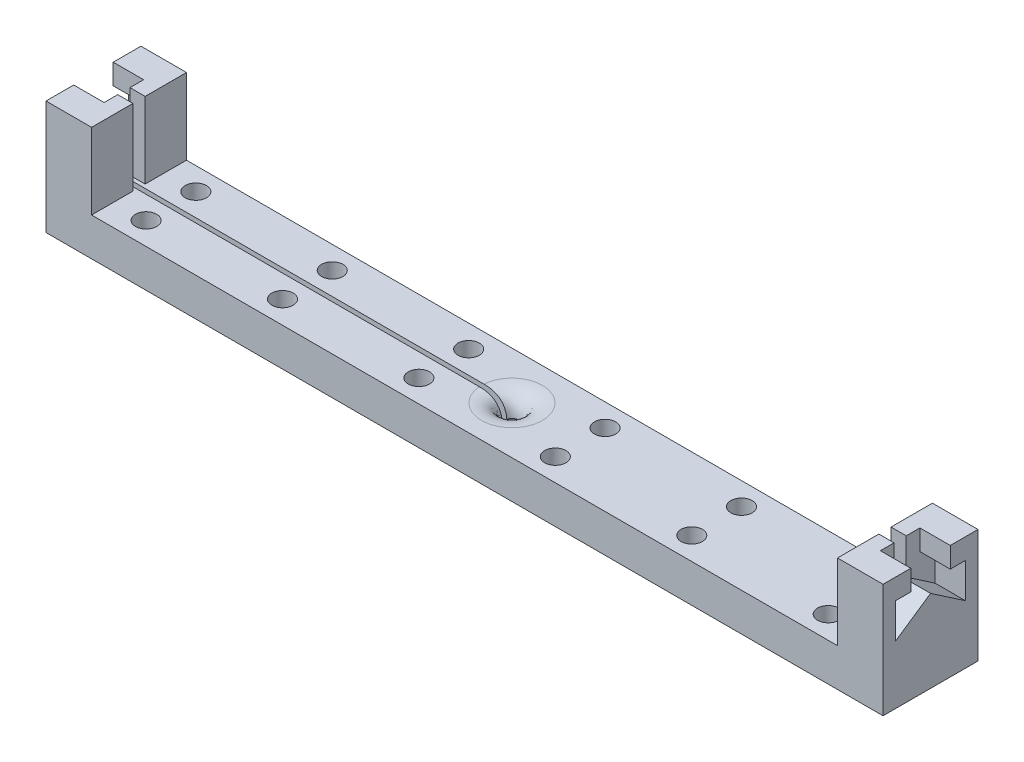
from build123d import *

# Parameters (mm, degrees)
SKETCH1_R                = 1.778
BOSS_EXTRUDE1_DEPTH      = 19.05
CUT_EXTRUDE1_DEPTH       = 143.133881397
SKETCH4_W                = 64.897
SKETCH4_H                = 12.7
CUT_EXTRUDE6_DEPTH       = 143.133881397
BOSS_EXTRUDE3_DEPTH      = 7.112
BOSS_EXTRUDE3_DEPTH_BACK = 6.35
SKETCH5_7_W              = 2.54
SKETCH5_7_H              = 6.9215
BOSS_EXTRUDE4_DEPTH      = 12.7
FILLET1_SIZE             = 3.81


with BuildPart() as part:
    # Sketch1 → Boss-Extrude1 (new body)
    with BuildSketch(Plane(origin=(0, 0, 0), x_dir=(1, 0, 0), z_dir=(0, 1, 0))):
        with BuildLine():
            Line((0, 7.5565), (0, 0))
            Line((0, 0), (139.954, 0))
            Line((139.954, 0), (139.954, 15.875))
            Line((139.954, 15.875), (0, 15.875))
            Line((0, 15.875), (0, 8.3185))
            Line((0, 8.3185), (68.765497214, 8.3185))
            ThreePointArc((68.765497214, 8.3185), (71.247, 7.9375), (68.765497214, 7.5565))
            Line((68.765497214, 7.5565), (0, 7.5565))
        make_face()
        with Locations(Location((127, 12.09675, 0), (0, 0, 90))):
            Circle(SKETCH1_R, mode=Mode.SUBTRACT)
        with Locations(Location((12.954, 3.77825, 0), (0, 0, 90))):
            Circle(SKETCH1_R, mode=Mode.SUBTRACT)
        with Locations(Location((35.7632, 3.77825, 0), (0, 0, 90))):
            Circle(SKETCH1_R, mode=Mode.SUBTRACT)
        with Locations(Location((58.5724, 3.77825, 0), (0, 0, 90))):
            Circle(SKETCH1_R, mode=Mode.SUBTRACT)
        with Locations(Location((81.3816, 3.77825, 0), (0, 0, 90))):
            Circle(SKETCH1_R, mode=Mode.SUBTRACT)
        with Locations(Location((104.1908, 3.77825, 0), (0, 0, 90))):
            Circle(SKETCH1_R, mode=Mode.SUBTRACT)
        with Locations(Location((127, 3.77825, 0), (0, 0, 90))):
            Circle(SKETCH1_R, mode=Mode.SUBTRACT)
        with Locations(Location((12.954, 12.09675, 0), (0, 0, 90))):
            Circle(SKETCH1_R, mode=Mode.SUBTRACT)
        with Locations(Location((35.7632, 12.09675, 0), (0, 0, 90))):
            Circle(SKETCH1_R, mode=Mode.SUBTRACT)
        with Locations(Location((58.5724, 12.09675, 0), (0, 0, 90))):
            Circle(SKETCH1_R, mode=Mode.SUBTRACT)
        with Locations(Location((81.3816, 12.09675, 0), (0, 0, 90))):
            Circle(SKETCH1_R, mode=Mode.SUBTRACT)
        with Locations(Location((104.1908, 12.09675, 0), (0, 0, 90))):
            Circle(SKETCH1_R, mode=Mode.SUBTRACT)
    extrude(amount=BOSS_EXTRUDE1_DEPTH)

    # Sketch2 → Cut-Extrude1 (cut, through all)
    with BuildSketch(Plane(origin=(139.954, 0, 0), x_dir=(0, 0, -1), z_dir=(1, 0, 0))):
        Polygon((7.9375, 13.762181818), (7.9375, 19.05), (4.6355, 19.05), (4.6355, 15.621), (2.0955, 15.621), (2.0955, 9.779), align=None)
        Polygon((11.2395, 15.621), (11.2395, 19.05), (7.9375, 19.05), (7.9375, 13.762181818), (13.7795, 9.779), (13.7795, 15.621), align=None)
    extrude(amount=-CUT_EXTRUDE1_DEPTH, mode=Mode.SUBTRACT)

    # Sketch4 → Cut-Extrude6 (cut, through all)
    with BuildSketch(Plane(origin=(0, 0, -15.875), x_dir=(-1, 0, 0), z_dir=(0, 0, -1))):
        with Locations((-102.4255, 12.7)):
            Rectangle(SKETCH4_W, SKETCH4_H)
        with Locations((-37.5285, 12.7)):
            Rectangle(SKETCH4_W, SKETCH4_H)
    extrude(amount=-CUT_EXTRUDE6_DEPTH, mode=Mode.SUBTRACT)

    # Sketch5 → Boss-Extrude3 (add, two sides: drawn at the far end of the back side and taken through both)
    with BuildSketch(Plane(origin=(0, 6.35, 0), x_dir=(1, 0, 0), z_dir=(0, 1, 0)).offset(-BOSS_EXTRUDE3_DEPTH_BACK)):
        Polygon((0.603994289, 8.3185), (5.08, 8.3185), (3.095997145, 8.001), (2.587997145, 8.001), align=None)
        Polygon((5.08, 7.5565), (0.603994289, 7.5565), (2.587997145, 7.874), (3.095997145, 7.874), align=None)
    extrude(amount=BOSS_EXTRUDE3_DEPTH + BOSS_EXTRUDE3_DEPTH_BACK)

    # Sketch5<7> → Boss-Extrude4 (add)
    with BuildSketch(Plane(origin=(0, 6.35, 0), x_dir=(1, 0, 0), z_dir=(0, 1, 0))):
        with Locations((6.35, 12.41425)):
            Rectangle(SKETCH5_7_W, SKETCH5_7_H)
        with Locations((6.35, 3.46075)):
            Rectangle(SKETCH5_7_W, SKETCH5_7_H)
        with Locations((133.604, 12.41425)):
            Rectangle(SKETCH5_7_W, SKETCH5_7_H)
        with Locations((133.604, 3.46075)):
            Rectangle(SKETCH5_7_W, SKETCH5_7_H)
    extrude(amount=BOSS_EXTRUDE4_DEPTH)

    # Fillet1
    # a fillet whose section is not a circle: 3.81 mm, written as the material it takes off along each edge
    with BuildSketch(Plane(origin=(69.977, 6.35, -7.9375), x_dir=(-0.9999950652018582, 0, -0.003141587485879583), z_dir=(-0.003141587485879583, 0, 0.9999950652018582))) as fillet1_piece_1:
        with BuildLine():
            Bezier((1.27, FILLET1_SIZE), (1.27, 0), (1.27 + FILLET1_SIZE, 0), weights=[1, 1, 1])
            Line((1.27 + FILLET1_SIZE, 0), (1.27, 0))
            Line((1.27, 0), (1.27, FILLET1_SIZE))
        make_face()
    revolve(axis=Axis((69.977, 6.35, -7.9375), (0, -1, 0)), revolution_arc=359.64, mode=Mode.SUBTRACT)
    with BuildSketch(Plane(origin=(69.977, 0, -7.9375), x_dir=(-0.9999950652018582, 0, -0.003141587485879583), z_dir=(-0.003141587485879583, 0, 0.9999950652018582))) as fillet1_piece_2:
        with BuildLine():
            Bezier((1.27, -FILLET1_SIZE), (1.27, 0), (1.27 + FILLET1_SIZE, 0), weights=[1, 1, 1])
            Line((1.27 + FILLET1_SIZE, 0), (1.27, 0))
            Line((1.27, 0), (1.27, -FILLET1_SIZE))
        make_face()
    revolve(axis=Axis((69.977, 0, -7.9375), (0, -1, 0)), revolution_arc=359.64, mode=Mode.SUBTRACT)


solid = part.part
